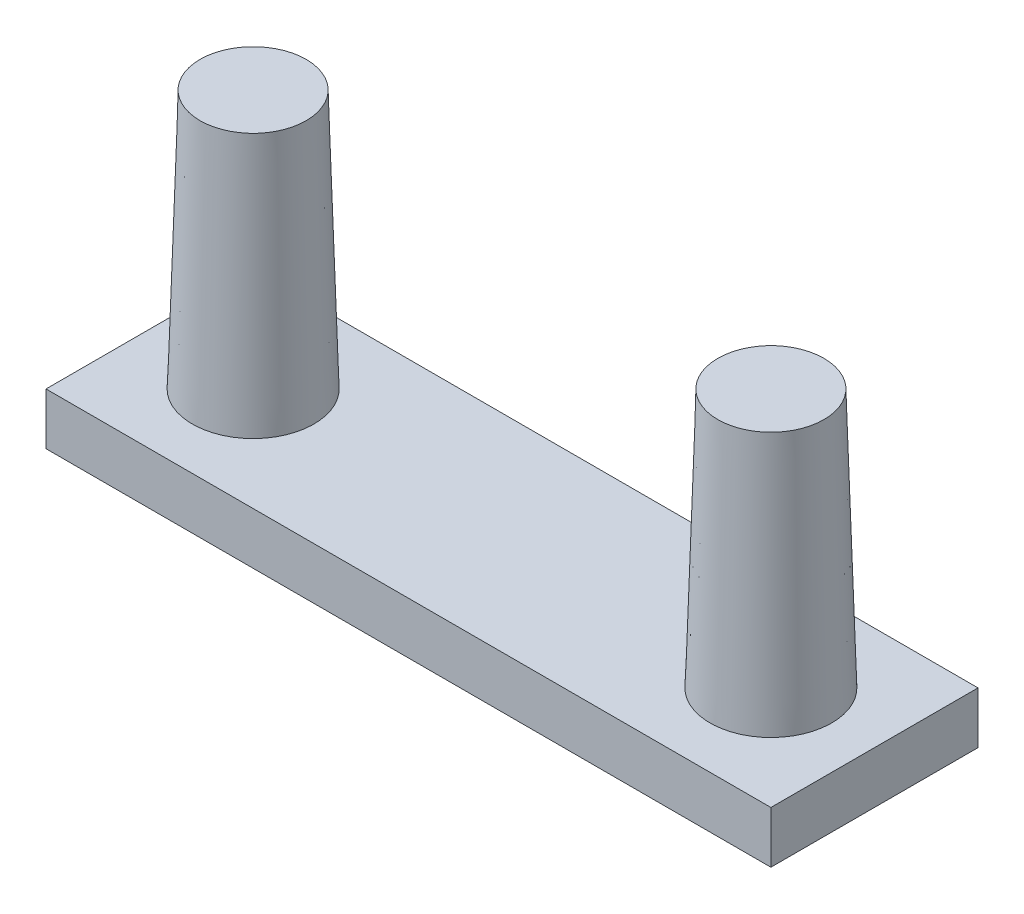
from build123d import *

# Parameters (mm, degrees)
SKETCH2_W                    = 28
SKETCH2_H                    = 8
BOSS_EXTRUDE1_DEPTH          = 2
SKETCH3_R                    = 2.35
BOSS_EXTRUDE2_DEPTH          = 10
CHAMFER1_SIZE                = 10
CHAMFER1_SIZE_2              = 0.3
LPATTERN1_COUNT              = 2
LPATTERN1_PITCH              = 20
CHAMFER1_OF_LPATTERN1_SIZE   = 10
CHAMFER1_OF_LPATTERN1_SIZE_2 = 0.3


with BuildPart() as part:
    # Sketch2 → Boss-Extrude1 (new body)
    with BuildSketch(Plane(origin=(0, 0, 0), x_dir=(1, 0, 0), z_dir=(0, 1, 0))):
        Rectangle(SKETCH2_W, SKETCH2_H)
    extrude(amount=BOSS_EXTRUDE1_DEPTH)

    # Sketch3 → Boss-Extrude2 (add)
    with BuildSketch(Plane(origin=(0, 2, 0), x_dir=(1, 0, 0), z_dir=(0, 1, 0))):
        with Locations(Location((10, 0, 0), (0, 0, 90))):
            Circle(SKETCH3_R)
    boss_extrude2 = extrude(amount=BOSS_EXTRUDE2_DEPTH)

    # Chamfer1
    # the kernel refuses this chamfer: 10, 0.3 mm, written as the material it takes off along each edge
    with BuildSketch(Plane(origin=(10, 12, 0), x_dir=(0, 0, -1), z_dir=(1, 0, 0))) as chamfer1_piece_1_section:
        Polygon((2.35, -CHAMFER1_SIZE), (2.35 - CHAMFER1_SIZE_2, 0), (2.35, 0), align=None)
    chamfer1_piece_1 = revolve(axis=Axis((10, 12, 0), (0, 1, 0)), mode=Mode.PRIVATE)
    chamfer1_piece_1 = split(chamfer1_piece_1, bisect_by=Plane(origin=(10, 2, 2.231636086), z_dir=(0, 1, 0)), keep=Keep.TOP, mode=Mode.PRIVATE)
    add(chamfer1_piece_1, mode=Mode.SUBTRACT)

    # LPattern1: Boss-Extrude2 ×2
    with Locations(*[(-i * LPATTERN1_PITCH, 0, 0) for i in range(1, LPATTERN1_COUNT)]):
        add(boss_extrude2)

    # Chamfer1 of LPattern1
    # the kernel refuses this chamfer: 10, 0.3 mm, written as the material it takes off along each edge
    with BuildSketch(Plane(origin=(-10, 12, 0), x_dir=(0, 0, -1), z_dir=(1, 0, 0))) as chamfer1_of_lpattern1_piece_1_section:
        Polygon((2.35, -CHAMFER1_OF_LPATTERN1_SIZE), (2.35 - CHAMFER1_OF_LPATTERN1_SIZE_2, 0), (2.35, 0), align=None)
    chamfer1_of_lpattern1_piece_1 = revolve(axis=Axis((-10, 12, 0), (0, 1, 0)), mode=Mode.PRIVATE)
    chamfer1_of_lpattern1_piece_1 = split(chamfer1_of_lpattern1_piece_1, bisect_by=Plane(origin=(-10, 2, 2.231636086), z_dir=(0, 1, 0)), keep=Keep.TOP, mode=Mode.PRIVATE)
    add(chamfer1_of_lpattern1_piece_1, mode=Mode.SUBTRACT)


solid = part.part
